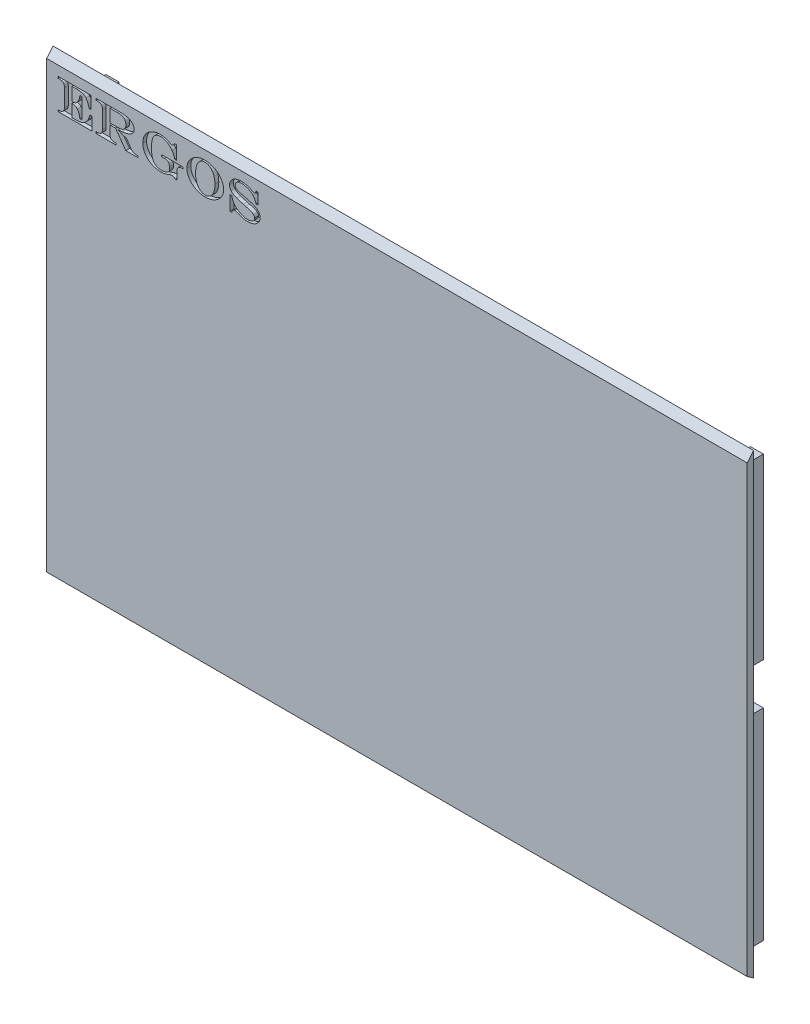
from build123d import *

# Parameters (mm, degrees)
SKETCH2_W           = 165.1
SKETCH2_H           = 107.67
BOSS_EXTRUDE1_DEPTH = 1.5
SKETCH3_W           = 3.025
SKETCH3_H           = 99.31
BOSS_EXTRUDE2_DEPTH = 7.4
CHAMFER2_SIZE2      = 1.5
CHAMFER2_SIZE       = 1.050311307
CHAMFER3_SIZE       = 1.78763
CHAMFER3_SIZE2      = 1.499999674
CUT_EXTRUDE1_START  = -0.9
CUT_EXTRUDE1_DEPTH  = 0.9
CUT_EXTRUDE3_DEPTH  = 169.985701635


# Read off the part's stored shape, not the designer's step: Cut-Extrude1
with BuildPart() as part:
    # Sketch2 → Boss-Extrude1 (new body)
    with BuildSketch(Plane.XY):
        Rectangle(SKETCH2_W, SKETCH2_H)
    extrude(amount=BOSS_EXTRUDE1_DEPTH)

    # Sketch3 → Boss-Extrude2 (add)
    with BuildSketch(Plane(origin=(0, 0, 0), x_dir=(-1, 0, 0), z_dir=(0, 0, -1))):
        with Locations((-75.9475, -2.79)):
            Rectangle(SKETCH3_W, SKETCH3_H)
        with Locations((75.9475, -2.79)):
            Rectangle(SKETCH3_W, SKETCH3_H)
    extrude(amount=BOSS_EXTRUDE2_DEPTH)

    # Chamfer2
    chamfer2_edges = [part.edges().sort_by_distance(p)[0] for p in [
        (0, -53.835, 1.5),
    ]]
    chamfer2_side = [part.faces().sort_by_distance(p)[0] for p in [
        (0, -53.813993774, 1.5),
    ]]
    chamfer(chamfer2_edges, length=CHAMFER2_SIZE - 0.0001, length2=CHAMFER2_SIZE2 - 0.0001, reference=chamfer2_side[0])  # a hair under: the kernel refuses the full size

    # Chamfer3
    chamfer3_edges = [part.edges().sort_by_distance(p)[0] for p in [
        (0, 53.835, 1.5),
    ]]
    chamfer3_side = [part.faces().sort_by_distance(p)[0] for p in [
        (0, 0.525105653, 1.5),
    ]]
    chamfer(chamfer3_edges, length=CHAMFER3_SIZE, length2=CHAMFER3_SIZE2, reference=chamfer3_side[0])

    # Cut-Extrude1 outline → Cut-Extrude1 (cut)
    # profile 1 of 5: a face of its own
    with BuildSketch(Plane.XY.offset(1.5).offset(CUT_EXTRUDE1_START)):
        with BuildLine():
            add(Edge.make_bspline(
                [(-33.673735662, 49.058404936), (-33.647669884, 49.060120862), (-33.595582847, 49.063549784), (-33.520661469, 49.092950171), (-33.451149091, 49.139881919), (-33.386971586, 49.205383568), (-33.327959262, 49.288723101), (-33.273314633, 49.389579844), (-33.225506474, 49.509347613), (-33.197899303, 49.595740547), (-33.183282237, 49.641482692)],
                knots=[0, 0, 0, 0, 0.095615682, 0.191068058, 0.291769804, 0.402365532, 0.526393257, 0.666376207, 0.823357453, 1, 1, 1, 1], degree=3))
            add(Edge.make_bspline(
                [(-34.173299676, 49.26339321), (-34.140982655, 49.247042087), (-34.080179814, 49.216278277), (-33.992963799, 49.175052767), (-33.915893654, 49.140408322), (-33.84878231, 49.111035811), (-33.791052071, 49.088194806), (-33.743193206, 49.071142096), (-33.705001579, 49.061145933), (-33.682878831, 49.059206493), (-33.673735662, 49.058404936)],
                knots=[0, 0, 0, 0, 0.200425727, 0.377090874, 0.533798689, 0.668043957, 0.782475738, 0.877256726, 0.949271104, 1, 1, 1, 1], degree=3))
            add(Edge.make_bspline(
                [(-36.640751115, 49.93302157), (-36.539436361, 49.93097345), (-36.335305179, 49.926846853), (-36.029049231, 49.893169463), (-35.721508087, 49.842266997), (-35.413335146, 49.768272915), (-35.103862812, 49.674432982), (-34.79333256, 49.558089886), (-34.481625112, 49.421560429), (-34.27704007, 49.316610777), (-34.173299676, 49.26339321)],
                knots=[0, 0, 0, 0, 0.117664495, 0.237072998, 0.357512053, 0.47958756, 0.604949098, 0.732946784, 0.864583425, 1, 1, 1, 1], degree=3))
            add(Edge.make_bspline(
                [(-39.439220655, 47.775330188), (-39.437921839, 47.826489355), (-39.435343094, 47.92806371), (-39.418738644, 48.078489295), (-39.389526529, 48.224574848), (-39.350056742, 48.366246521), (-39.299665423, 48.504004875), (-39.237565827, 48.637830562), (-39.162111436, 48.767035654), (-39.077767731, 48.89299768), (-38.982176633, 49.012768236), (-38.876613134, 49.124904904), (-38.763949491, 49.232485411), (-38.641097995, 49.33175593), (-38.510156405, 49.425261506), (-38.369789827, 49.509466024), (-38.222109182, 49.589756734), (-38.011053261, 49.683598145), (-37.733468429, 49.785205626), (-37.383709615, 49.870736743), (-37.017465594, 49.924357594), (-36.767982735, 49.930095397), (-36.640751115, 49.93302157)],
                knots=[0, 0, 0, 0, 0.038971493, 0.077376244, 0.115107398, 0.152338832, 0.189297768, 0.226728302, 0.264555857, 0.303159433, 0.342117573, 0.381127191, 0.420400756, 0.460685165, 0.501336906, 0.542862355, 0.585296084, 0.629298266, 0.718697782, 0.810057838, 0.903133029, 1, 1, 1, 1], degree=3))
            add(Edge.make_bspline(
                [(-39.109720986, 46.821755109), (-39.160412613, 46.89412855), (-39.260095793, 47.036448203), (-39.3629531, 47.27347774), (-39.42677966, 47.520926736), (-39.435043443, 47.689911196), (-39.439220655, 47.775330188)],
                knots=[0, 0, 0, 0, 0.257658078, 0.506674932, 0.750631924, 1, 1, 1, 1], degree=3))
            add(Edge.make_bspline(
                [(-37.767427403, 45.954730634), (-37.849624591, 45.986092463), (-38.005961505, 46.045741847), (-38.225791039, 46.138937584), (-38.416807379, 46.234928923), (-38.585707655, 46.329826588), (-38.735014527, 46.43367327), (-38.870610576, 46.550270248), (-38.997316951, 46.678829534), (-39.072117116, 46.773940502), (-39.109720986, 46.821755109)],
                knots=[0, 0, 0, 0, 0.162597773, 0.309256734, 0.441034827, 0.557526682, 0.667037542, 0.776516434, 0.887649353, 1, 1, 1, 1], degree=3))
            add(Edge.make_bspline(
                [(-36.174592597, 45.467314072), (-36.26719621, 45.493198806), (-36.444836615, 45.542853181), (-36.700545349, 45.613104364), (-36.932276243, 45.682474797), (-37.14286581, 45.743955337), (-37.330564216, 45.803043728), (-37.495746056, 45.858187432), (-37.639717616, 45.905789352), (-37.727040899, 45.939253611), (-37.767427403, 45.954730634)],
                knots=[0, 0, 0, 0, 0.17311511, 0.332084649, 0.477412506, 0.608598903, 0.727051977, 0.831656342, 0.92214205, 1, 1, 1, 1], degree=3))
            Line((-36.174592597, 45.467314072), (-35.671991719, 45.333692087))
            add(Edge.make_bspline(
                [(-33.796728626, 44.591179008), (-33.845518296, 44.633543594), (-33.951313904, 44.725407038), (-34.113806492, 44.810891346), (-34.262629116, 44.885039027), (-34.396398378, 44.939487759), (-34.54523939, 44.998003812), (-34.713628283, 45.056051977), (-34.907300142, 45.11737043), (-35.131172072, 45.185974893), (-35.390138912, 45.258362261), (-35.574253494, 45.307569929), (-35.671991719, 45.333692087)],
                knots=[0, 0, 0, 0, 0.095058532, 0.206125086, 0.269252981, 0.340546635, 0.419045255, 0.505254492, 0.603271131, 0.718797856, 0.850722316, 1, 1, 1, 1], degree=3))
            add(Edge.make_bspline(
                [(-33.518855633, 43.982287914), (-33.521739214, 44.03744219), (-33.527512365, 44.147865285), (-33.585407218, 44.306908392), (-33.672118463, 44.459292867), (-33.754198051, 44.546165076), (-33.796728626, 44.591179008)],
                knots=[0, 0, 0, 0, 0.239838849, 0.480175786, 0.730646522, 1, 1, 1, 1], degree=3))
            add(Edge.make_bspline(
                [(-35.172427705, 42.838908878), (-35.095906707, 42.840483853), (-34.94533557, 42.843582948), (-34.725724455, 42.873082112), (-34.516870049, 42.920436456), (-34.320683629, 42.984656087), (-34.140483111, 43.066185059), (-33.979546048, 43.161334306), (-33.841203294, 43.271865425), (-33.724420313, 43.394807773), (-33.633520773, 43.530222917), (-33.565809248, 43.673610636), (-33.527455433, 43.825940965), (-33.521734155, 43.929955518), (-33.518855633, 43.982287914)],
                knots=[0, 0, 0, 0, 0.102905249, 0.202487694, 0.297472894, 0.390713923, 0.479700354, 0.563083208, 0.641567444, 0.71720244, 0.790293303, 0.860063715, 0.929594457, 1, 1, 1, 1], degree=3))
            add(Edge.make_bspline(
                [(-38.23206749, 44.298121698), (-38.167910444, 44.228149255), (-38.037837462, 44.086286044), (-37.818981467, 43.892085828), (-37.583097649, 43.705181001), (-37.328260235, 43.533521062), (-37.063571178, 43.374002956), (-36.791009033, 43.23697358), (-36.517431371, 43.115601352), (-36.241847944, 43.016127478), (-35.967838025, 42.935670938), (-35.697191282, 42.883002186), (-35.433187293, 42.844279872), (-35.258608367, 42.840683983), (-35.172427705, 42.838908878)],
                knots=[0, 0, 0, 0, 0.081776267, 0.165794465, 0.25184825, 0.341026787, 0.430434453, 0.518036847, 0.603793757, 0.688252523, 0.77040959, 0.849636053, 0.925773031, 1, 1, 1, 1], degree=3))
            add(Edge.make_bspline(
                [(-38.897140554, 45.881845914), (-38.885882482, 45.804763759), (-38.863689511, 45.652812164), (-38.815438904, 45.430206512), (-38.751215289, 45.217969798), (-38.675021816, 45.014379529), (-38.585908156, 44.820107808), (-38.48229474, 44.635805115), (-38.364803978, 44.461187515), (-38.276448675, 44.352643664), (-38.23206749, 44.298121698)],
                knots=[0, 0, 0, 0, 0.134073388, 0.264298074, 0.391646335, 0.515443055, 0.638242392, 0.759173001, 0.879031733, 1, 1, 1, 1], degree=3))
            Line((-38.897140554, 45.881845914), (-39.349633188, 45.881845914))
            Line((-39.349633188, 45.881845914), (-39.349633188, 42.450190374))
            Line((-39.349633188, 42.450190374), (-38.906251144, 42.450190374))
            add(Edge.make_bspline(
                [(-38.14096159, 43.203332475), (-38.184141841, 43.201150991), (-38.268459438, 43.196891233), (-38.391564909, 43.16729847), (-38.505954248, 43.116529823), (-38.613537072, 43.045701856), (-38.712044736, 42.946618006), (-38.790131645, 42.810288084), (-38.859292595, 42.6430475), (-38.889842873, 42.517578574), (-38.906251144, 42.450190374)],
                knots=[0, 0, 0, 0, 0.109848072, 0.214499113, 0.320034099, 0.426842473, 0.540687667, 0.671896365, 0.823778573, 1, 1, 1, 1], degree=3))
            add(Edge.make_bspline(
                [(-37.170683763, 42.928496345), (-37.233255683, 42.954301308), (-37.34972671, 43.002334523), (-37.514081273, 43.061806018), (-37.6514323, 43.112135156), (-37.798476663, 43.155019466), (-37.957634701, 43.194904017), (-38.082002087, 43.20062181), (-38.14096159, 43.203332475)],
                knots=[0, 0, 0, 0, 0.200164531, 0.372585152, 0.516999432, 0.632577406, 0.825814033, 1, 1, 1, 1], degree=3))
            add(Edge.make_bspline(
                [(-35.19520418, 42.450190374), (-35.277750199, 42.451181867), (-35.440556368, 42.453137397), (-35.679777633, 42.47379149), (-35.910159487, 42.504853995), (-36.135859444, 42.551769882), (-36.367961602, 42.616165409), (-36.616246493, 42.700739509), (-36.887806941, 42.803734634), (-37.073374044, 42.885578276), (-37.170683763, 42.928496345)],
                knots=[0, 0, 0, 0, 0.120753913, 0.238163902, 0.35107058, 0.460731701, 0.575182342, 0.703288774, 0.844407304, 1, 1, 1, 1], degree=3))
            add(Edge.make_bspline(
                [(-32.859856295, 43.288364648), (-32.929152348, 43.221261623), (-33.068057332, 43.086752598), (-33.307048536, 42.916044104), (-33.569379958, 42.771918486), (-33.854455864, 42.653215348), (-34.161623115, 42.562590453), (-34.488480409, 42.49822785), (-34.835339716, 42.457768069), (-35.073108888, 42.452761344), (-35.19520418, 42.450190374)],
                knots=[0, 0, 0, 0, 0.113357576, 0.227226969, 0.34422936, 0.464878134, 0.589783684, 0.720342317, 0.856394812, 1, 1, 1, 1], degree=3))
            add(Edge.make_bspline(
                [(-32.240336179, 44.673174317), (-32.242510262, 44.613320772), (-32.246903701, 44.492367307), (-32.2791802, 44.310310695), (-32.328963113, 44.125947941), (-32.400507528, 43.942129074), (-32.489530944, 43.762808131), (-32.594102018, 43.59133289), (-32.717863277, 43.432282767), (-32.8123038, 43.336561845), (-32.859856295, 43.288364648)],
                knots=[0, 0, 0, 0, 0.11533341, 0.233068496, 0.355438412, 0.482999863, 0.612593659, 0.740943727, 0.869560528, 1, 1, 1, 1], degree=3))
            add(Edge.make_bspline(
                [(-32.831006093, 45.962322792), (-32.783165418, 45.914983318), (-32.689571937, 45.822370368), (-32.565218289, 45.673959831), (-32.465013829, 45.517252718), (-32.382325919, 45.357245457), (-32.317428034, 45.192628699), (-32.274538595, 45.023070252), (-32.245221371, 44.849818578), (-32.24197732, 44.73251653), (-32.240336179, 44.673174317)],
                knots=[0, 0, 0, 0, 0.138219231, 0.270406279, 0.396718167, 0.51947566, 0.639953373, 0.759231824, 0.878197213, 1, 1, 1, 1], degree=3))
            add(Edge.make_bspline(
                [(-35.14965123, 46.946266504), (-35.066580959, 46.924737281), (-34.905772941, 46.883060857), (-34.673703595, 46.818822232), (-34.457858733, 46.758379866), (-34.258936724, 46.700162116), (-34.07790442, 46.639736971), (-33.913185182, 46.584215412), (-33.764701317, 46.531700823), (-33.59330763, 46.461361383), (-33.398477867, 46.371797149), (-33.186145202, 46.250060834), (-32.995905809, 46.11564219), (-32.885141268, 46.012656246), (-32.831006093, 45.962322792)],
                knots=[0, 0, 0, 0, 0.101060651, 0.195633925, 0.283570652, 0.365043448, 0.439688609, 0.508301999, 0.569770025, 0.625115199, 0.726447956, 0.822045087, 0.913026136, 1, 1, 1, 1], degree=3))
            Line((-35.14965123, 46.946266504), (-35.54444346, 47.044964562))
            Line((-35.54444346, 47.044964562), (-35.798021547, 47.104183396))
            add(Edge.make_bspline(
                [(-36.03034159, 47.167957526), (-36.004082519, 47.159648349), (-35.956276432, 47.144521034), (-35.890681027, 47.126863524), (-35.839855235, 47.11240306), (-35.810201426, 47.106576552), (-35.798021547, 47.104183396)],
                knots=[0, 0, 0, 0, 0.342746122, 0.62398823, 0.845558529, 1, 1, 1, 1], degree=3))
            add(Edge.make_bspline(
                [(-37.899530957, 47.886175699), (-37.849610765, 47.84209994), (-37.744098786, 47.748940833), (-37.586253151, 47.655146231), (-37.438581115, 47.58746075), (-37.308560154, 47.533762477), (-37.161402291, 47.481308425), (-36.994234433, 47.427365358), (-36.800753203, 47.370438735), (-36.575298808, 47.308890048), (-36.314519498, 47.240455697), (-36.12907055, 47.193144808), (-36.03034159, 47.167957526)],
                knots=[0, 0, 0, 0, 0.098621157, 0.208446982, 0.27058147, 0.339592069, 0.417008968, 0.502239864, 0.600106632, 0.716123941, 0.848870602, 1, 1, 1, 1], degree=3))
            add(Edge.make_bspline(
                [(-38.106037662, 48.429774231), (-38.103427841, 48.375366709), (-38.09843043, 48.271184568), (-38.059917745, 48.123201867), (-37.994672459, 47.992289745), (-37.931100055, 47.921385619), (-37.899530957, 47.886175699)],
                knots=[0, 0, 0, 0, 0.273181187, 0.523100483, 0.763178887, 1, 1, 1, 1], degree=3))
            add(Edge.make_bspline(
                [(-37.811461921, 49.113068476), (-37.849402452, 49.069102291), (-37.930095487, 48.975593718), (-38.022996404, 48.809110417), (-38.091731545, 48.623993348), (-38.101335529, 48.49361016), (-38.106037662, 48.429774231)],
                knots=[0, 0, 0, 0, 0.228673321, 0.486349129, 0.74851527, 1, 1, 1, 1], degree=3))
            add(Edge.make_bspline(
                [(-36.651380137, 49.544303066), (-36.710643153, 49.543176856), (-36.825921369, 49.540986156), (-36.994174447, 49.522825824), (-37.1516926, 49.491155038), (-37.299424557, 49.447103052), (-37.43865033, 49.388471915), (-37.570860179, 49.314037159), (-37.696767574, 49.222214799), (-37.772757342, 49.149900828), (-37.811461921, 49.113068476)],
                knots=[0, 0, 0, 0, 0.13957811, 0.271506861, 0.398006454, 0.517573642, 0.634051402, 0.753100297, 0.874244264, 1, 1, 1, 1], degree=3))
            add(Edge.make_bspline(
                [(-33.906055705, 48.420663641), (-33.954721651, 48.474724372), (-34.05353149, 48.584487618), (-34.221759228, 48.734507055), (-34.408778243, 48.874672166), (-34.612527591, 49.006027576), (-34.832761571, 49.125849701), (-35.067291922, 49.232142306), (-35.315415055, 49.324842086), (-35.574791455, 49.4024774), (-35.840540156, 49.467354935), (-36.110279982, 49.510071288), (-36.380464049, 49.539143964), (-36.561210914, 49.542585958), (-36.651380137, 49.544303066)],
                knots=[0, 0, 0, 0, 0.071444271, 0.145058251, 0.221065176, 0.300954302, 0.38309134, 0.467237206, 0.553809308, 0.643191066, 0.733196278, 0.82241456, 0.911407917, 1, 1, 1, 1], degree=3))
            add(Edge.make_bspline(
                [(-33.180245374, 47.017632792), (-33.208337886, 47.092634667), (-33.263034541, 47.238664746), (-33.347014993, 47.450197084), (-33.435909051, 47.646137155), (-33.524677309, 47.829196061), (-33.618000577, 47.996984582), (-33.709508621, 48.152859964), (-33.80538385, 48.293025831), (-33.873197945, 48.379004604), (-33.906055705, 48.420663641)],
                knots=[0, 0, 0, 0, 0.151415398, 0.294808661, 0.43014741, 0.558099912, 0.679294196, 0.793016882, 0.89971109, 1, 1, 1, 1], degree=3))
            Line((-33.180245374, 47.017632792), (-32.739900194, 47.017632792))
            Line((-32.739900194, 47.017632792), (-32.739900194, 49.641482692))
            Line((-32.739900194, 49.641482692), (-33.183282237, 49.641482692))
        make_face()
    # profile 2 of 5: a face of its own
    with BuildSketch(Plane.XY.offset(1.5).offset(CUT_EXTRUDE1_START)):
        with BuildLine():
            add(Edge.make_bspline(
                [(-49.491238211, 46.187050677), (-49.489560572, 46.270143274), (-49.486226831, 46.43526183), (-49.45721728, 46.680212896), (-49.414515606, 46.921264478), (-49.349395676, 47.156784148), (-49.26901096, 47.388938069), (-49.170110295, 47.616099405), (-49.05411747, 47.839772879), (-48.919046816, 48.056740051), (-48.769823451, 48.267026564), (-48.606404837, 48.465902676), (-48.433072369, 48.655567095), (-48.246270271, 48.833033428), (-48.046475863, 48.998794218), (-47.83564962, 49.153613511), (-47.612537735, 49.29712693), (-47.378334243, 49.428570832), (-47.134801202, 49.546388719), (-46.885370175, 49.649826671), (-46.631590895, 49.738359595), (-46.37244517, 49.810107776), (-46.107997281, 49.864312475), (-45.838806677, 49.903582377), (-45.565067966, 49.929126504), (-45.38090027, 49.931717615), (-45.28821939, 49.93302157)],
                knots=[0, 0, 0, 0, 0.039950268, 0.079387706, 0.11849316, 0.157586488, 0.196773689, 0.236570132, 0.276638895, 0.317848719, 0.359391541, 0.400567558, 0.441571949, 0.482897373, 0.524383096, 0.566353807, 0.608624899, 0.651894979, 0.695445596, 0.738664974, 0.78170091, 0.824637586, 0.867892599, 0.911443216, 0.955434526, 1, 1, 1, 1], degree=3))
            add(Edge.make_bspline(
                [(-45.184966038, 42.450190374), (-45.330370878, 42.453906697), (-45.618048879, 42.461259302), (-46.042555457, 42.513259154), (-46.4535038, 42.6018761), (-46.849104611, 42.72490675), (-47.227298174, 42.878634635), (-47.582995926, 43.066145604), (-47.918474705, 43.279306759), (-48.227925779, 43.524435387), (-48.509865163, 43.793623942), (-48.761253782, 44.085643982), (-48.979103416, 44.399573969), (-49.162895958, 44.733128493), (-49.308982454, 45.082271182), (-49.414501681, 45.442643138), (-49.478703093, 45.812235376), (-49.487048843, 46.06178348), (-49.491238211, 46.187050677)],
                knots=[0, 0, 0, 0, 0.068900731, 0.136317501, 0.202323329, 0.267873014, 0.332415683, 0.395501385, 0.458179017, 0.520514241, 0.582266648, 0.642651566, 0.702801641, 0.763026277, 0.822807443, 0.881784886, 0.940658832, 1, 1, 1, 1], degree=3))
            add(Edge.make_bspline(
                [(-40.842251504, 46.170347929), (-40.844159116, 46.08829745), (-40.847948393, 45.925312451), (-40.873568766, 45.68289848), (-40.920113437, 45.445693825), (-40.982091324, 45.211973022), (-41.063280554, 44.982947846), (-41.159977762, 44.756799153), (-41.278087362, 44.536993922), (-41.41120615, 44.321792549), (-41.559646383, 44.114146564), (-41.722616774, 43.916436335), (-41.898533832, 43.729069068), (-42.089843096, 43.554846823), (-42.291880544, 43.387956644), (-42.508872287, 43.233745267), (-42.739676333, 43.090796221), (-42.981044837, 42.957735722), (-43.232554349, 42.837359282), (-43.492749801, 42.734796507), (-43.758592926, 42.645942716), (-44.031674394, 42.574962763), (-44.310880196, 42.518245513), (-44.597000721, 42.479694736), (-44.888906949, 42.454018752), (-45.085706205, 42.451473916), (-45.184966038, 42.450190374)],
                knots=[0, 0, 0, 0, 0.038790927, 0.077054263, 0.115066877, 0.152969373, 0.191262626, 0.22984635, 0.269131561, 0.30910595, 0.349411987, 0.389700974, 0.430157312, 0.470800745, 0.511948215, 0.553978872, 0.596540195, 0.64023465, 0.684224912, 0.728259406, 0.772374445, 0.816658539, 0.861568531, 0.906982486, 0.953084666, 1, 1, 1, 1], degree=3))
            add(Edge.make_bspline(
                [(-41.943114454, 48.662094274), (-41.855865413, 48.568408697), (-41.684608671, 48.384518005), (-41.460863718, 48.087820246), (-41.269612444, 47.782455607), (-41.114767309, 47.467024487), (-40.992610389, 47.146857909), (-40.905568015, 46.822880307), (-40.851739801, 46.497104161), (-40.845402498, 46.278861284), (-40.842251504, 46.170347929)],
                knots=[0, 0, 0, 0, 0.137402136, 0.269699722, 0.398353005, 0.523782047, 0.646434017, 0.765755337, 0.883530337, 1, 1, 1, 1], degree=3))
            add(Edge.make_bspline(
                [(-45.28821939, 49.93302157), (-45.203152693, 49.932455602), (-45.03487138, 49.931335989), (-44.785230415, 49.913042689), (-44.540435974, 49.888082098), (-44.30075001, 49.851594887), (-44.066599066, 49.804653786), (-43.838112517, 49.746649446), (-43.614998962, 49.678647293), (-43.397843452, 49.599386162), (-43.187295174, 49.511264418), (-42.983424659, 49.416345862), (-42.789239192, 49.311094906), (-42.602880117, 49.198639081), (-42.425525255, 49.076709335), (-42.254893271, 48.94806435), (-42.093726798, 48.809977581), (-41.99318835, 48.711260851), (-41.943114454, 48.662094274)],
                knots=[0, 0, 0, 0, 0.069453335, 0.137394525, 0.204313319, 0.27037126, 0.335303558, 0.399264219, 0.462809485, 0.52570479, 0.587961187, 0.649165833, 0.709271917, 0.768251742, 0.826837729, 0.884955231, 0.942701126, 1, 1, 1, 1], degree=3))
        make_face()
        with BuildLine():
            add(Edge.make_bspline(
                [(-44.190393304, 49.248208893), (-44.261130594, 49.290561368), (-44.408191205, 49.378610838), (-44.65371519, 49.465658229), (-44.905190914, 49.532558604), (-45.075742646, 49.540493209), (-45.157634268, 49.544303066)],
                knots=[0, 0, 0, 0, 0.2410126, 0.501057651, 0.7604293, 1, 1, 1, 1], degree=3))
            add(Edge.make_bspline(
                [(-42.883023649, 46.238677353), (-42.884410589, 46.351630034), (-42.887140001, 46.573913877), (-42.919487062, 46.900835758), (-42.966437803, 47.216758557), (-43.037225411, 47.519157939), (-43.12220603, 47.806836735), (-43.225743511, 48.076253198), (-43.347066729, 48.324950993), (-43.483973553, 48.554670166), (-43.637293388, 48.76243956), (-43.804445754, 48.949885517), (-43.989337707, 49.112093598), (-44.123598803, 49.202988798), (-44.190393304, 49.248208893)],
                knots=[0, 0, 0, 0, 0.099026676, 0.194878331, 0.287858186, 0.378957216, 0.46701283, 0.550768689, 0.631768914, 0.709420604, 0.784975818, 0.857895264, 0.929303312, 1, 1, 1, 1], degree=3))
            add(Edge.make_bspline(
                [(-45.218371534, 42.838908878), (-45.160092989, 42.839865246), (-45.044709681, 42.841758719), (-44.875447428, 42.863120452), (-44.710769818, 42.891836148), (-44.553607526, 42.939006038), (-44.400410044, 42.99409037), (-44.254324671, 43.06531291), (-44.11302799, 43.146496337), (-43.978895472, 43.241691796), (-43.851023796, 43.347841365), (-43.731157547, 43.466690196), (-43.618788281, 43.596697947), (-43.511547808, 43.736027989), (-43.414990605, 43.888721282), (-43.325187286, 44.052207203), (-43.241505594, 44.226170886), (-43.167494283, 44.412182697), (-43.101219978, 44.607962569), (-43.040782844, 44.813177559), (-42.994069482, 45.028718393), (-42.951414977, 45.252695921), (-42.922769717, 45.486143844), (-42.899245907, 45.728599655), (-42.885591187, 45.980386972), (-42.883889193, 46.151604963), (-42.883023649, 46.238677353)],
                knots=[0, 0, 0, 0, 0.037767174, 0.074773683, 0.110500551, 0.146026344, 0.181022088, 0.215960839, 0.251256955, 0.286588151, 0.322475969, 0.358913384, 0.395902423, 0.433844608, 0.472812063, 0.512915722, 0.554754672, 0.597905466, 0.642639894, 0.688760357, 0.736535179, 0.785589384, 0.836558457, 0.888975832, 0.943538996, 1, 1, 1, 1], degree=3))
            add(Edge.make_bspline(
                [(-47.450466067, 46.173384792), (-47.448595445, 46.04676828), (-47.444945222, 45.79969624), (-47.411581299, 45.438769795), (-47.362054013, 45.09632591), (-47.28667106, 44.774518848), (-47.195020806, 44.473175968), (-47.08435708, 44.194775175), (-46.956224667, 43.938972846), (-46.811789782, 43.706809036), (-46.650221631, 43.501731055), (-46.478815758, 43.322382829), (-46.294906951, 43.171647355), (-46.099410128, 43.049295645), (-45.893159924, 42.954490092), (-45.676846595, 42.887133684), (-45.45067107, 42.846921175), (-45.296479199, 42.841602907), (-45.218371534, 42.838908878)],
                knots=[0, 0, 0, 0, 0.084896836, 0.165662711, 0.242907028, 0.316768572, 0.387097901, 0.453978153, 0.517434321, 0.578747888, 0.637012528, 0.692227878, 0.744820295, 0.796058783, 0.846486888, 0.896626254, 0.947634841, 1, 1, 1, 1], degree=3))
            add(Edge.make_bspline(
                [(-46.560665117, 48.967299037), (-46.602907844, 48.919831867), (-46.689920806, 48.822057425), (-46.810267529, 48.658268466), (-46.92312732, 48.473520105), (-47.032707876, 48.271699693), (-47.129772551, 48.05243645), (-47.21746943, 47.820688137), (-47.2896933, 47.575921469), (-47.349015452, 47.318834398), (-47.393706974, 47.049941265), (-47.427610402, 46.768819958), (-47.447374829, 46.475334793), (-47.449424245, 46.275149207), (-47.450466067, 46.173384792)],
                knots=[0, 0, 0, 0, 0.063510628, 0.130821285, 0.202866299, 0.279850497, 0.360268004, 0.442423182, 0.527446273, 0.615221763, 0.706075612, 0.799857734, 0.898257607, 1, 1, 1, 1], degree=3))
            add(Edge.make_bspline(
                [(-45.157634268, 49.544303066), (-45.224015742, 49.542447384), (-45.355257774, 49.538778538), (-45.549132781, 49.512718808), (-45.736962417, 49.467951309), (-45.919359435, 49.407680372), (-46.095501958, 49.329061067), (-46.260662842, 49.227761264), (-46.418369431, 49.108588783), (-46.512599934, 49.015024429), (-46.560665117, 48.967299037)],
                knots=[0, 0, 0, 0, 0.127582399, 0.252241659, 0.375188359, 0.498250484, 0.621039261, 0.745009464, 0.869934191, 1, 1, 1, 1], degree=3))
        make_face(mode=Mode.SUBTRACT)
    # profile 3 of 5: a face of its own
    with BuildSketch(Plane.XY.offset(1.5).offset(CUT_EXTRUDE1_START)):
        with BuildLine():
            add(Edge.make_bspline(
                [(-53.085365938, 49.155584562), (-53.059917363, 49.157160265), (-53.007546073, 49.160402944), (-52.9289739, 49.184291273), (-52.851675, 49.225177348), (-52.770927146, 49.280381278), (-52.68597198, 49.358006405), (-52.592257141, 49.459860552), (-52.491472566, 49.590380242), (-52.422482779, 49.686794942), (-52.385368945, 49.738662318)],
                knots=[0, 0, 0, 0, 0.080825371, 0.166332652, 0.258410516, 0.357902822, 0.47638606, 0.623217043, 0.79730536, 1, 1, 1, 1], degree=3))
            add(Edge.make_bspline(
                [(-53.622890744, 49.369683426), (-53.588974696, 49.352993938), (-53.52479604, 49.321412757), (-53.433849431, 49.276424483), (-53.351740685, 49.240792257), (-53.280478935, 49.209409413), (-53.21791193, 49.186578162), (-53.165179743, 49.170303442), (-53.122378025, 49.157726344), (-53.096559641, 49.156232309), (-53.085365938, 49.155584562)],
                knots=[0, 0, 0, 0, 0.195106327, 0.36919579, 0.523568034, 0.657002843, 0.771052385, 0.866894112, 0.942291204, 1, 1, 1, 1], degree=3))
            add(Edge.make_bspline(
                [(-55.854985277, 49.93302157), (-55.762816021, 49.931101844), (-55.578126566, 49.927255083), (-55.302575895, 49.90135254), (-55.028962438, 49.856378383), (-54.755497626, 49.795697296), (-54.479786425, 49.71523289), (-54.198012412, 49.619974658), (-53.91089431, 49.504184022), (-53.720177282, 49.415117229), (-53.622890744, 49.369683426)],
                knots=[0, 0, 0, 0, 0.119079741, 0.238612888, 0.35719242, 0.477132702, 0.600281621, 0.728080837, 0.861291494, 1, 1, 1, 1], degree=3))
            add(Edge.make_bspline(
                [(-58.86755368, 48.701573497), (-58.799563724, 48.765293601), (-58.66401372, 48.892330899), (-58.445608332, 49.065711661), (-58.216294048, 49.223102931), (-57.97730981, 49.36691529), (-57.72821242, 49.492916078), (-57.473208597, 49.608330366), (-57.209922298, 49.704689923), (-56.941898358, 49.78684219), (-56.670662078, 49.852135121), (-56.398417912, 49.899650416), (-56.126363126, 49.927578234), (-55.945140558, 49.931213222), (-55.854985277, 49.93302157)],
                knots=[0, 0, 0, 0, 0.083855212, 0.167180196, 0.250719166, 0.334093964, 0.418048143, 0.50187488, 0.585919266, 0.670234922, 0.754112412, 0.836883711, 0.918852297, 1, 1, 1, 1], degree=3))
            add(Edge.make_bspline(
                [(-59.889458184, 46.109610662), (-59.887900675, 46.190639562), (-59.884809546, 46.351454612), (-59.862969322, 46.591351858), (-59.827067035, 46.827815239), (-59.774434559, 47.060759821), (-59.710545495, 47.28960479), (-59.628953374, 47.511074425), (-59.53690482, 47.726149449), (-59.429248222, 47.933499375), (-59.31024572, 48.135584347), (-59.174834419, 48.329852026), (-59.030155903, 48.521359722), (-58.922122254, 48.641094566), (-58.86755368, 48.701573497)],
                knots=[0, 0, 0, 0, 0.085162435, 0.169018722, 0.252988002, 0.336370426, 0.419896986, 0.502529277, 0.584260977, 0.665635216, 0.747932875, 0.830570303, 0.91441984, 1, 1, 1, 1], degree=3))
            add(Edge.make_bspline(
                [(-55.604444054, 42.353010748), (-55.753398342, 42.3560328), (-56.047166586, 42.361992903), (-56.479576599, 42.41479764), (-56.896376995, 42.501879514), (-57.296855709, 42.62055547), (-57.676158749, 42.774118574), (-58.032052422, 42.956930802), (-58.362940279, 43.168416929), (-58.667587276, 43.408543557), (-58.942445277, 43.676071823), (-59.186642396, 43.966779435), (-59.397359016, 44.280571432), (-59.575669621, 44.614123575), (-59.715518932, 44.967231318), (-59.81582356, 45.335853527), (-59.878781922, 45.718223834), (-59.885875674, 45.978277515), (-59.889458184, 46.109610662)],
                knots=[0, 0, 0, 0, 0.070218678, 0.138485558, 0.205048106, 0.270818171, 0.335171607, 0.397724176, 0.45923029, 0.520063108, 0.5803187, 0.639786367, 0.698767343, 0.758238842, 0.81780557, 0.877443501, 0.938106122, 1, 1, 1, 1], degree=3))
            add(Edge.make_bspline(
                [(-53.868876672, 42.700731597), (-53.953698574, 42.66975335), (-54.114455702, 42.611042405), (-54.346758349, 42.536741777), (-54.555576893, 42.475296197), (-54.748877511, 42.427485659), (-54.940391578, 42.392045692), (-55.144508263, 42.37118946), (-55.367809834, 42.354721924), (-55.523424681, 42.353596625), (-55.604444054, 42.353010748)],
                knots=[0, 0, 0, 0, 0.152008665, 0.288091587, 0.410521598, 0.518402402, 0.623196942, 0.738091602, 0.863639912, 1, 1, 1, 1], degree=3))
            add(Edge.make_bspline(
                [(-53.009444355, 42.919385755), (-53.068773939, 42.91774317), (-53.18455117, 42.914537788), (-53.330651088, 42.890125889), (-53.456026596, 42.857463795), (-53.571766909, 42.816479061), (-53.712963681, 42.765058541), (-53.813869503, 42.723426582), (-53.868876672, 42.700731597)],
                knots=[0, 0, 0, 0, 0.19904517, 0.388421714, 0.495567048, 0.633647398, 0.800288835, 1, 1, 1, 1], degree=3))
            add(Edge.make_bspline(
                [(-52.239599506, 42.567109612), (-52.277643647, 42.602012402), (-52.348081205, 42.666633846), (-52.451978004, 42.749480839), (-52.543687555, 42.812669031), (-52.628764997, 42.857290265), (-52.713858375, 42.884468305), (-52.803342493, 42.907103998), (-52.903495253, 42.91603761), (-52.973000795, 42.918234086), (-53.009444355, 42.919385755)],
                knots=[0, 0, 0, 0, 0.17709764, 0.327890846, 0.455526907, 0.558820888, 0.656023135, 0.761326662, 0.874857374, 1, 1, 1, 1], degree=3))
            Line((-52.239599506, 42.567109612), (-51.823549233, 42.567109612))
            Line((-51.823549233, 42.567109612), (-51.823549233, 44.351266806))
            add(Edge.make_bspline(
                [(-50.740907463, 45.559938403), (-50.784451213, 45.558912819), (-50.869181592, 45.556917168), (-50.992360225, 45.545854413), (-51.106904145, 45.522220327), (-51.213115718, 45.492188307), (-51.311834506, 45.455057829), (-51.400003132, 45.405196907), (-51.481596774, 45.349083673), (-51.554737498, 45.283470136), (-51.620464033, 45.207829253), (-51.674368097, 45.11904454), (-51.719776626, 45.019378459), (-51.758068887, 44.908594961), (-51.787953135, 44.786110922), (-51.809037527, 44.651525254), (-51.820755844, 44.505343775), (-51.822594519, 44.403926645), (-51.823549233, 44.351266806)],
                knots=[0, 0, 0, 0, 0.069718191, 0.135662379, 0.197629528, 0.256611802, 0.312279157, 0.36594734, 0.418315558, 0.470526863, 0.522813545, 0.578120091, 0.636120428, 0.697870045, 0.765465796, 0.837658587, 0.915705831, 1, 1, 1, 1], degree=3))
            Line((-50.740907463, 45.559938403), (-50.385594456, 45.559938403))
            Line((-50.385594456, 45.559938403), (-50.385594456, 45.948656907))
            Line((-50.385594456, 45.948656907), (-55.499672269, 45.948656907))
            Line((-55.499672269, 45.948656907), (-55.499672269, 45.559938403))
            Line((-55.499672269, 45.559938403), (-54.781454097, 45.559938403))
            add(Edge.make_bspline(
                [(-53.572782499, 44.351266806), (-53.573660427, 44.399883281), (-53.575374209, 44.494786363), (-53.588531175, 44.632528748), (-53.61281193, 44.760534477), (-53.646607224, 44.878852952), (-53.68835076, 44.988136668), (-53.740620227, 45.087792338), (-53.801444705, 45.17867241), (-53.87355666, 45.259164243), (-53.954048492, 45.331276198), (-54.044928565, 45.392100676), (-54.144584235, 45.444370143), (-54.25386795, 45.486113678), (-54.372186426, 45.519908973), (-54.500192154, 45.544189727), (-54.637934539, 45.557346693), (-54.732837622, 45.559060476), (-54.781454097, 45.559938403)],
                knots=[0, 0, 0, 0, 0.074361619, 0.145159578, 0.211363504, 0.273364158, 0.33317502, 0.389968325, 0.445155765, 0.5, 0.554844235, 0.610031675, 0.66682498, 0.726635842, 0.788636496, 0.854840422, 0.925638381, 1, 1, 1, 1], degree=3))
            Line((-53.572782499, 44.351266806), (-53.572782499, 43.980769482))
            add(Edge.make_bspline(
                [(-54.040459449, 43.124374029), (-54.003435839, 43.151484879), (-53.931141718, 43.204422859), (-53.83466312, 43.294448073), (-53.753048042, 43.392160694), (-53.688311735, 43.497693759), (-53.635016527, 43.608094736), (-53.59873259, 43.726308612), (-53.577360044, 43.85143026), (-53.574326019, 43.937157114), (-53.572782499, 43.980769482)],
                knots=[0, 0, 0, 0, 0.135042791, 0.263691198, 0.387544651, 0.508723551, 0.627401738, 0.747614321, 0.871602227, 1, 1, 1, 1], degree=3))
            add(Edge.make_bspline(
                [(-55.561927967, 42.741729252), (-55.491000094, 42.742587012), (-55.348819668, 42.744306459), (-55.136673194, 42.767995785), (-54.924271312, 42.798189588), (-54.716628251, 42.845538477), (-54.51879024, 42.902019642), (-54.338626303, 42.966088543), (-54.179568727, 43.038712719), (-54.085508075, 43.096633792), (-54.040459449, 43.124374029)],
                knots=[0, 0, 0, 0, 0.133933598, 0.268480292, 0.402911394, 0.539099662, 0.670454854, 0.791453351, 0.900120403, 1, 1, 1, 1], degree=3))
            add(Edge.make_bspline(
                [(-57.466041263, 43.797039252), (-57.438310857, 43.751587478), (-57.383939846, 43.662470178), (-57.294097534, 43.539002201), (-57.202853154, 43.425043771), (-57.075244235, 43.289534127), (-56.899443719, 43.139760571), (-56.665473995, 42.990898254), (-56.412316907, 42.875754746), (-56.143022481, 42.795780536), (-55.85809236, 42.75003373), (-55.662311679, 42.744544021), (-55.561927967, 42.741729252)],
                knots=[0, 0, 0, 0, 0.069736716, 0.136732789, 0.199914311, 0.260906845, 0.380389184, 0.501447697, 0.623131325, 0.743570609, 0.86851954, 1, 1, 1, 1], degree=3))
            add(Edge.make_bspline(
                [(-57.84868604, 46.001802015), (-57.847177818, 45.87979198), (-57.844252843, 45.643171239), (-57.823378306, 45.302112455), (-57.788718662, 44.990041683), (-57.743076232, 44.705094311), (-57.683320008, 44.437278868), (-57.624788152, 44.222764733), (-57.575059056, 44.059816587), (-57.537095458, 43.95634157), (-57.502795552, 43.8696522), (-57.477496153, 43.819669898), (-57.466041263, 43.797039252)],
                knots=[0, 0, 0, 0, 0.162384967, 0.314922058, 0.454556559, 0.580145161, 0.698807313, 0.819573333, 0.876035624, 0.92547449, 0.966256847, 1, 1, 1, 1], degree=3))
            add(Edge.make_bspline(
                [(-57.100099234, 49.012851987), (-57.130464559, 48.980395178), (-57.192381755, 48.914213291), (-57.277688453, 48.804290578), (-57.355682872, 48.682747412), (-57.429957531, 48.550971439), (-57.495425358, 48.407202219), (-57.556548483, 48.252563988), (-57.612582814, 48.087441688), (-57.662642803, 47.910564135), (-57.707028985, 47.721116562), (-57.743851528, 47.517705344), (-57.778462211, 47.30023796), (-57.80250514, 47.067972351), (-57.8250724, 46.822085797), (-57.837190923, 46.561682539), (-57.847234331, 46.286839046), (-57.84819362, 46.098486598), (-57.84868604, 46.001802015)],
                knots=[0, 0, 0, 0, 0.041998368, 0.085637849, 0.131287141, 0.178406978, 0.228496052, 0.280468996, 0.335540363, 0.393240225, 0.454166296, 0.51938204, 0.588602368, 0.66225254, 0.740046994, 0.821971666, 0.908614963, 1, 1, 1, 1], degree=3))
            add(Edge.make_bspline(
                [(-55.730473881, 49.544303066), (-55.791809537, 49.54244478), (-55.915007237, 49.53871226), (-56.099886705, 49.511457526), (-56.286032865, 49.469248152), (-56.470218021, 49.408640448), (-56.648706179, 49.334641492), (-56.813205055, 49.242110548), (-56.966354928, 49.138096286), (-57.055549513, 49.054570388), (-57.100099234, 49.012851987)],
                knots=[0, 0, 0, 0, 0.122293046, 0.245635623, 0.371989885, 0.502552279, 0.631919004, 0.756633602, 0.878446599, 1, 1, 1, 1], degree=3))
            add(Edge.make_bspline(
                [(-52.973001996, 48.025871411), (-53.014480595, 48.082954052), (-53.097180866, 48.19676575), (-53.230183299, 48.359748111), (-53.374430687, 48.510637193), (-53.522264859, 48.65700655), (-53.682504563, 48.789102439), (-53.848823227, 48.914785677), (-54.022767596, 49.031643111), (-54.204748995, 49.13733837), (-54.390450772, 49.232174258), (-54.577779114, 49.317190733), (-54.767582887, 49.385958967), (-54.957781991, 49.444838819), (-55.149317037, 49.488297985), (-55.341927282, 49.520445959), (-55.535660806, 49.541136804), (-55.665636769, 49.54324928), (-55.730473881, 49.544303066)],
                knots=[0, 0, 0, 0, 0.064750178, 0.129099277, 0.192847104, 0.256243682, 0.319878031, 0.383233758, 0.447517446, 0.512045667, 0.576235314, 0.638818434, 0.700685581, 0.761369704, 0.821424848, 0.88075715, 0.940516986, 1, 1, 1, 1], degree=3))
            add(Edge.make_bspline(
                [(-52.338297564, 46.533253094), (-52.368259683, 46.630562588), (-52.424457583, 46.813079363), (-52.509039283, 47.066378973), (-52.587447098, 47.28136239), (-52.683141682, 47.512371918), (-52.801696168, 47.762219055), (-52.917469565, 47.940402888), (-52.973001996, 48.025871411)],
                knots=[0, 0, 0, 0, 0.187549168, 0.351773169, 0.491890154, 0.608936765, 0.812420707, 1, 1, 1, 1], degree=3))
            Line((-52.338297564, 46.533253094), (-51.908581406, 46.533253094))
            Line((-51.908581406, 46.533253094), (-51.961726513, 49.738662318))
            Line((-51.961726513, 49.738662318), (-52.385368945, 49.738662318))
        make_face()
    # profile 4 of 5: a face of its own
    with BuildSketch(Plane.XY.offset(1.5).offset(CUT_EXTRUDE1_START)):
        with BuildLine():
            add(Edge.make_bspline(
                [(-67.663828257, 44.102244015), (-67.662889873, 44.051604992), (-67.661085307, 43.954223294), (-67.649155969, 43.813633787), (-67.628572329, 43.68447598), (-67.597746426, 43.566806685), (-67.560375793, 43.459528934), (-67.51316604, 43.363025189), (-67.457053308, 43.277793916), (-67.392560404, 43.203213869), (-67.318163453, 43.141056803), (-67.237049112, 43.085585291), (-67.147381946, 43.038731902), (-67.049176351, 43.000305746), (-66.942505091, 42.972378005), (-66.827930183, 42.950560432), (-66.704921183, 42.939001139), (-66.620180327, 42.937077222), (-66.576631192, 42.936088504)],
                knots=[0, 0, 0, 0, 0.082520417, 0.158691418, 0.22974685, 0.295366456, 0.356676582, 0.414591378, 0.469953594, 0.522562169, 0.574631289, 0.62747857, 0.682452318, 0.739126214, 0.798953626, 0.86188466, 0.929021209, 1, 1, 1, 1], degree=3))
            Line((-67.663828257, 44.102244015), (-67.663828257, 45.948656907))
            Line((-67.663828257, 45.948656907), (-66.326089969, 45.948656907))
            Line((-66.326089969, 45.948656907), (-63.889007163, 42.54737))
            Line((-63.889007163, 42.54737), (-61.025245062, 42.54737))
            Line((-61.025245062, 42.54737), (-61.025245062, 42.936088504))
            Line((-61.025245062, 42.936088504), (-61.415481997, 42.936088504))
            add(Edge.make_bspline(
                [(-62.211140184, 43.113745007), (-62.161348044, 43.086053194), (-62.055855241, 43.027383554), (-61.86886209, 42.973845742), (-61.652568669, 42.940818613), (-61.497627663, 42.93772739), (-61.415481997, 42.936088504)],
                knots=[0, 0, 0, 0, 0.206473268, 0.43744743, 0.701749352, 1, 1, 1, 1], degree=3))
            add(Edge.make_bspline(
                [(-63.132828199, 44.273826792), (-63.083228445, 44.199071117), (-62.988277059, 44.055962445), (-62.844051354, 43.856234972), (-62.713165485, 43.67433963), (-62.588854586, 43.515926567), (-62.476528822, 43.379630908), (-62.375713632, 43.269226054), (-62.291811021, 43.180076436), (-62.235841866, 43.134055914), (-62.211140184, 43.113745007)],
                knots=[0, 0, 0, 0, 0.181120289, 0.346727978, 0.497375848, 0.633526611, 0.753252842, 0.8538262, 0.935486991, 1, 1, 1, 1], degree=3))
            add(Edge.make_bspline(
                [(-63.562544357, 44.90549436), (-63.536708903, 44.868055105), (-63.488946513, 44.798840596), (-63.422445827, 44.701791122), (-63.367495198, 44.61930473), (-63.304211414, 44.527034266), (-63.22744847, 44.413541861), (-63.165732674, 44.322413114), (-63.132828199, 44.273826792)],
                knots=[0, 0, 0, 0, 0.178623159, 0.330223293, 0.461970904, 0.567814805, 0.769575573, 1, 1, 1, 1], degree=3))
            Line((-63.562544357, 44.90549436), (-63.737163997, 45.1712199))
            add(Edge.make_bspline(
                [(-65.682894431, 45.949040348), (-65.626825668, 45.914472487), (-65.466339457, 45.817061723), (-65.198994849, 45.669268878), (-64.877335485, 45.518024725), (-64.604138048, 45.408366111), (-64.371725893, 45.333862718), (-64.178345477, 45.277991476), (-63.964534639, 45.223327728), (-63.815190355, 45.189101646), (-63.737163997, 45.1712199)],
                knots=[0.082249325, 0.082249325, 0.082249325, 0.082249325, 0.168304452, 0.327528884, 0.481054288, 0.632463067, 0.711719524, 0.799828005, 0.895418216, 1, 1, 1, 1], degree=3))
            add(Edge.make_bspline(
                [(-64.806139882, 45.980543972), (-64.876983127, 45.975698666), (-65.029205088, 45.965287483), (-65.273225548, 45.955052856), (-65.494680656, 45.950234659), (-65.634602699, 45.949250944), (-65.682894431, 45.949040348)],
                knots=[0, 0, 0, 0, 0.205254569, 0.441033626, 0.705916483, 0.845511825, 0.845511825, 0.845511825, 0.845511825], degree=3))
            add(Edge.make_bspline(
                [(-62.845844616, 46.469478965), (-62.90110462, 46.441722196), (-63.01998586, 46.382008863), (-63.219524766, 46.30711854), (-63.448402638, 46.232273), (-63.792730239, 46.138565791), (-64.24772518, 46.043035081), (-64.619949717, 46.001380153), (-64.806139882, 45.980543972)],
                knots=[0, 0, 0, 0, 0.091291063, 0.196395113, 0.314376202, 0.446967289, 0.72336791, 1, 1, 1, 1], degree=3))
            add(Edge.make_bspline(
                [(-61.930230328, 47.831512159), (-61.932526034, 47.76443432), (-61.937082091, 47.631311636), (-61.983788655, 47.437089804), (-62.055125559, 47.251012297), (-62.157090317, 47.074738691), (-62.287831337, 46.908631396), (-62.446535167, 46.75091196), (-62.633693821, 46.602070995), (-62.773539739, 46.514668757), (-62.845844616, 46.469478965)],
                knots=[0, 0, 0, 0, 0.116621788, 0.231447609, 0.345866725, 0.462741403, 0.584579617, 0.71297543, 0.851598986, 1, 1, 1, 1], degree=3))
            add(Edge.make_bspline(
                [(-62.455607681, 48.99766767), (-62.413693592, 48.953925044), (-62.331267444, 48.867902984), (-62.225338964, 48.727320311), (-62.134248379, 48.581762418), (-62.060678625, 48.430873685), (-62.002937464, 48.278226924), (-61.962289154, 48.127101589), (-61.933923889, 47.978851142), (-61.931451571, 47.880228467), (-61.930230328, 47.831512159)],
                knots=[0, 0, 0, 0, 0.138504915, 0.272376833, 0.401880022, 0.530838413, 0.655804163, 0.774636719, 0.888678067, 1, 1, 1, 1], degree=3))
            add(Edge.make_bspline(
                [(-65.352775278, 49.738662318), (-65.260652798, 49.737961737), (-65.080426142, 49.736591133), (-64.817140167, 49.729358326), (-64.567493965, 49.715940137), (-64.332628379, 49.695911442), (-64.111209438, 49.6722354), (-63.904172935, 49.641684577), (-63.710461573, 49.607401472), (-63.530129364, 49.566092867), (-63.361319666, 49.519190415), (-63.202424067, 49.466102692), (-63.05351939, 49.405830798), (-62.914964173, 49.336918848), (-62.78557993, 49.262482848), (-62.664967449, 49.18245622), (-62.555118825, 49.094012724), (-62.488547494, 49.029559456), (-62.455607681, 48.99766767)],
                knots=[0, 0, 0, 0, 0.090152612, 0.176372843, 0.257726584, 0.334769825, 0.407026291, 0.475603599, 0.539531748, 0.599489312, 0.656573055, 0.710924611, 0.763353089, 0.813636621, 0.862232969, 0.909352937, 0.955147399, 1, 1, 1, 1], degree=3))
            Line((-65.352775278, 49.738662318), (-70.881384934, 49.738662318))
            Line((-70.881384934, 49.738662318), (-70.881384934, 49.349943814))
            Line((-70.881384934, 49.349943814), (-70.592882919, 49.349943814))
            add(Edge.make_bspline(
                [(-69.413061523, 48.176196145), (-69.413817788, 48.225335244), (-69.415278905, 48.320272821), (-69.429762295, 48.457130829), (-69.449766716, 48.584493033), (-69.481833997, 48.700722157), (-69.521825856, 48.807520179), (-69.569299485, 48.904624093), (-69.628240391, 48.990923998), (-69.69548009, 49.067502822), (-69.772253738, 49.135277596), (-69.859724363, 49.193194677), (-69.957316494, 49.24163405), (-70.064959105, 49.280795398), (-70.1819933, 49.31350043), (-70.310453523, 49.333179637), (-70.448301406, 49.347686661), (-70.543743488, 49.349176667), (-70.592882919, 49.349943814)],
                knots=[0, 0, 0, 0, 0.076665231, 0.148118534, 0.21461354, 0.277664082, 0.335914464, 0.392441223, 0.445904041, 0.498519684, 0.551135326, 0.605253656, 0.661780415, 0.7207707, 0.783821242, 0.851095359, 0.923334769, 1, 1, 1, 1], degree=3))
            Line((-69.413061523, 48.176196145), (-69.413061523, 44.109836173))
            add(Edge.make_bspline(
                [(-70.592882919, 42.936088504), (-70.543743049, 42.936842844), (-70.448803981, 42.938300243), (-70.311956332, 42.952809467), (-70.184558559, 42.972725182), (-70.067993255, 43.005222454), (-69.960354943, 43.044402442), (-69.86275763, 43.09283457), (-69.775302763, 43.150762619), (-69.698473028, 43.218501651), (-69.630978792, 43.295743451), (-69.570919634, 43.382186124), (-69.523512891, 43.480785662), (-69.481420938, 43.586891969), (-69.452141532, 43.703982074), (-69.429048034, 43.83019012), (-69.415531815, 43.9668136), (-69.413901268, 44.061217419), (-69.413061523, 44.109836173)],
                knots=[0, 0, 0, 0, 0.076747285, 0.148277062, 0.214843238, 0.277961262, 0.337014683, 0.393601942, 0.447778193, 0.500450149, 0.553122105, 0.607740995, 0.664328254, 0.723661663, 0.785811118, 0.852513387, 0.924043164, 1, 1, 1, 1], degree=3))
            Line((-70.592882919, 42.936088504), (-70.881384934, 42.936088504))
            Line((-70.881384934, 42.936088504), (-70.881384934, 42.54737))
            Line((-70.881384934, 42.54737), (-66.175765235, 42.54737))
            Line((-66.175765235, 42.54737), (-66.175765235, 42.936088504))
            Line((-66.175765235, 42.936088504), (-66.576631192, 42.936088504))
        make_face()
        with BuildLine():
            add(Edge.make_bspline(
                [(-63.873822846, 47.851251771), (-63.875158802, 47.912066906), (-63.877740669, 48.029598148), (-63.90106847, 48.200015695), (-63.938832622, 48.358848228), (-63.99132861, 48.506556526), (-64.060743252, 48.64201839), (-64.14495228, 48.765862135), (-64.243544697, 48.879050901), (-64.359719017, 48.978680345), (-64.490368798, 49.06648149), (-64.6363188, 49.14241385), (-64.795984011, 49.208406393), (-64.972041236, 49.25884881), (-65.162787688, 49.299789312), (-65.368632497, 49.330292518), (-65.589902996, 49.346197041), (-65.741976991, 49.348668473), (-65.820452228, 49.349943814)],
                knots=[0, 0, 0, 0, 0.065027747, 0.125672528, 0.183585091, 0.239417854, 0.292931661, 0.345941869, 0.399269102, 0.453004307, 0.509166871, 0.567291643, 0.628724052, 0.693652547, 0.762891866, 0.837318047, 0.916050704, 1, 1, 1, 1], degree=3))
            add(Edge.make_bspline(
                [(-65.850820861, 46.337375411), (-65.739892001, 46.339272216), (-65.529219759, 46.342874564), (-65.229677375, 46.373454265), (-64.963167559, 46.421308063), (-64.728372624, 46.492753786), (-64.52419984, 46.585864326), (-64.34653941, 46.69799086), (-64.198240112, 46.833908824), (-64.077190572, 46.991348556), (-63.985989894, 47.173150955), (-63.918070961, 47.377375234), (-63.881905372, 47.607035502), (-63.876590586, 47.767623586), (-63.873822846, 47.851251771)],
                knots=[0, 0, 0, 0, 0.116306649, 0.220885551, 0.315414364, 0.399866473, 0.477535349, 0.550124398, 0.619252019, 0.687410936, 0.757205826, 0.831566535, 0.912286239, 1, 1, 1, 1], degree=3))
            Line((-65.850820861, 46.337375411), (-67.663828257, 46.337375411))
            Line((-67.663828257, 46.337375411), (-67.663828257, 49.349943814))
            Line((-67.663828257, 49.349943814), (-65.820452228, 49.349943814))
        make_face(mode=Mode.SUBTRACT)
    # profile 5 of 5: a face of its own
    with BuildSketch(Plane.XY.offset(1.5).offset(CUT_EXTRUDE1_START)):
        with BuildLine():
            add(Edge.make_bspline(
                [(-72.503069941, 46.85060531), (-72.521124943, 46.912404275), (-72.555971046, 47.031676109), (-72.60903251, 47.203308516), (-72.660831101, 47.361020254), (-72.709519235, 47.505237921), (-72.754507352, 47.636920323), (-72.799886596, 47.754091034), (-72.842972399, 47.858135371), (-72.894902245, 47.980384626), (-72.967787634, 48.121580776), (-73.065648319, 48.284517369), (-73.174249378, 48.444913102), (-73.25692117, 48.545788984), (-73.298728128, 48.596801713)],
                knots=[0, 0, 0, 0, 0.099810661, 0.192634304, 0.278490378, 0.3571495, 0.428619214, 0.494194439, 0.551898452, 0.603208984, 0.700064232, 0.797896706, 0.897796774, 1, 1, 1, 1], degree=3))
            Line((-72.503069941, 46.85060531), (-72.082464373, 46.85060531))
            Line((-72.082464373, 46.85060531), (-72.082464373, 49.738662318))
            Line((-72.082464373, 49.738662318), (-79.82342895, 49.738662318))
            Line((-79.82342895, 49.738662318), (-79.82342895, 49.349943814))
            Line((-79.82342895, 49.349943814), (-79.534926935, 49.349943814))
            add(Edge.make_bspline(
                [(-78.353587108, 48.177714576), (-78.354342277, 48.226854236), (-78.355801277, 48.321792895), (-78.370299373, 48.45864338), (-78.390253297, 48.586031416), (-78.422492758, 48.702172462), (-78.461980416, 48.80948437), (-78.511640285, 48.905731088), (-78.570159031, 48.992522473), (-78.637616676, 49.068914386), (-78.713840207, 49.136962869), (-78.802231591, 49.193063919), (-78.899653466, 49.241243226), (-79.006404859, 49.283189699), (-79.124365584, 49.31282165), (-79.25243845, 49.333386654), (-79.390361719, 49.347629567), (-79.485793043, 49.349157263), (-79.534926935, 49.349943814)],
                knots=[0, 0, 0, 0, 0.076665235, 0.148118541, 0.214613551, 0.277664096, 0.33591448, 0.392798923, 0.446261744, 0.498877389, 0.551493034, 0.605177185, 0.661703947, 0.720973924, 0.783821231, 0.851095351, 0.923334765, 1, 1, 1, 1], degree=3))
            Line((-78.353587108, 48.177714576), (-78.353587108, 44.117428331))
            add(Edge.make_bspline(
                [(-79.534926935, 42.936088504), (-79.487310488, 42.936891504), (-79.394907218, 42.938449786), (-79.260939001, 42.952494143), (-79.135607919, 42.974269759), (-79.020156361, 43.008476789), (-78.912972844, 43.048985851), (-78.814601233, 43.099092183), (-78.726277285, 43.160413436), (-78.647075895, 43.230090163), (-78.577505863, 43.309367125), (-78.516590142, 43.39710261), (-78.466484637, 43.495474245), (-78.42597534, 43.602657756), (-78.391768378, 43.718109316), (-78.369992742, 43.843440397), (-78.355948391, 43.977408614), (-78.354390108, 44.069811884), (-78.353587108, 44.117428331)],
                knots=[0, 0, 0, 0, 0.074499557, 0.14457195, 0.210605695, 0.273280349, 0.332712356, 0.389752308, 0.445563418, 0.500559063, 0.554436582, 0.610247692, 0.667287644, 0.726719651, 0.789394305, 0.85542805, 0.925500443, 1, 1, 1, 1], degree=3))
            Line((-79.534926935, 42.936088504), (-79.82342895, 42.936088504))
            Line((-79.82342895, 42.936088504), (-79.808244633, 42.54737))
            Line((-79.808244633, 42.54737), (-71.897215711, 42.54737))
            Line((-71.897215711, 42.54737), (-71.897215711, 45.608528216))
            Line((-71.897215711, 45.608528216), (-72.351226776, 45.608528216))
            add(Edge.make_bspline(
                [(-72.69439233, 44.595734302), (-72.667622764, 44.660341865), (-72.609102782, 44.801578129), (-72.524650185, 45.034820864), (-72.438968397, 45.308533313), (-72.381752038, 45.504160155), (-72.351226776, 45.608528216)],
                knots=[0, 0, 0, 0, 0.196047636, 0.428572669, 0.695140184, 1, 1, 1, 1], degree=3))
            add(Edge.make_bspline(
                [(-73.432350114, 43.60268), (-73.355664798, 43.671789384), (-73.202300633, 43.810002325), (-73.003994137, 44.049105163), (-72.830988885, 44.310653339), (-72.740313761, 44.499894948), (-72.69439233, 44.595734302)],
                knots=[0, 0, 0, 0, 0.247963268, 0.495905625, 0.744706887, 1, 1, 1, 1], degree=3))
            add(Edge.make_bspline(
                [(-75.641668172, 42.936088504), (-75.560155345, 42.936879933), (-75.401059584, 42.938424636), (-75.169121793, 42.952813576), (-74.949630801, 42.973239706), (-74.742856735, 43.003671783), (-74.547372261, 43.042506971), (-74.363073882, 43.093333009), (-74.188735833, 43.151622499), (-74.024036048, 43.221145784), (-73.867148907, 43.300106991), (-73.716396817, 43.390547341), (-73.570080533, 43.490034466), (-73.47838368, 43.565030542), (-73.432350114, 43.60268)],
                knots=[0, 0, 0, 0, 0.103584922, 0.202175814, 0.295243871, 0.383669921, 0.467690332, 0.548369172, 0.626483806, 0.70115336, 0.775375462, 0.849511099, 0.924451707, 1, 1, 1, 1], degree=3))
            Line((-75.641668172, 42.936088504), (-76.604353841, 42.936088504))
            Line((-76.604353841, 42.936088504), (-76.604353841, 45.851477281))
            Line((-76.604353841, 45.851477281), (-76.507174215, 45.851477281))
            add(Edge.make_bspline(
                [(-75.296984186, 45.333692087), (-75.332861005, 45.375246135), (-75.403986677, 45.457626896), (-75.529081385, 45.561948694), (-75.663170039, 45.653010534), (-75.810334753, 45.726199419), (-75.969223809, 45.781826007), (-76.13849076, 45.82302313), (-76.319167552, 45.847774625), (-76.443320513, 45.850219728), (-76.507174215, 45.851477281)],
                knots=[0, 0, 0, 0, 0.120630647, 0.239149855, 0.35716027, 0.476711322, 0.599664549, 0.726907115, 0.859544295, 1, 1, 1, 1], degree=3))
            add(Edge.make_bspline(
                [(-74.709351136, 43.677083151), (-74.721243827, 43.747481472), (-74.744297832, 43.88394876), (-74.781772995, 44.080485141), (-74.821697398, 44.261527759), (-74.860999955, 44.427735969), (-74.90087037, 44.579163065), (-74.945436632, 44.715333975), (-74.991547974, 44.836984606), (-75.059715395, 44.979448714), (-75.154746688, 45.148553287), (-75.248821003, 45.271002051), (-75.296984186, 45.333692087)],
                knots=[0, 0, 0, 0, 0.120313889, 0.233228717, 0.337123804, 0.432703339, 0.521052328, 0.600892891, 0.674072548, 0.740080935, 0.866929358, 1, 1, 1, 1], degree=3))
            Line((-74.709351136, 43.677083151), (-74.255340071, 43.677083151))
            Line((-74.255340071, 43.677083151), (-74.255340071, 48.444958548))
            Line((-74.255340071, 48.444958548), (-74.712387999, 48.444958548))
            add(Edge.make_bspline(
                [(-74.8323441, 47.74040626), (-74.821805991, 47.781308516), (-74.797891279, 47.874130266), (-74.768431935, 48.032871907), (-74.740764329, 48.227110406), (-74.722346177, 48.368508547), (-74.712387999, 48.444958548)],
                knots=[0, 0, 0, 0, 0.177116941, 0.401941259, 0.676646447, 1, 1, 1, 1], degree=3))
            add(Edge.make_bspline(
                [(-75.189175539, 46.90526885), (-75.150308768, 46.965206054), (-75.071367903, 47.086942299), (-74.976890872, 47.289280865), (-74.894055081, 47.507330131), (-74.853231257, 47.661517582), (-74.8323441, 47.74040626)],
                knots=[0, 0, 0, 0, 0.234477993, 0.476239605, 0.732022518, 1, 1, 1, 1], degree=3))
            add(Edge.make_bspline(
                [(-76.426697338, 46.240195785), (-76.363318485, 46.242307345), (-76.239351634, 46.246437484), (-76.057864361, 46.276848618), (-75.887251215, 46.330636345), (-75.726453078, 46.403874185), (-75.575769505, 46.497655367), (-75.43556749, 46.612956621), (-75.303605684, 46.74829623), (-75.227920424, 46.852119514), (-75.189175539, 46.90526885)],
                knots=[0, 0, 0, 0, 0.129686648, 0.253662614, 0.375213056, 0.494805606, 0.614380211, 0.737334994, 0.865536226, 1, 1, 1, 1], degree=3))
            Line((-76.426697338, 46.240195785), (-76.604353841, 46.240195785))
            Line((-76.604353841, 46.240195785), (-76.604353841, 49.349943814))
            Line((-76.604353841, 49.349943814), (-75.415421855, 49.349943814))
            add(Edge.make_bspline(
                [(-73.95165374, 49.102439454), (-74.056694496, 49.140871221), (-74.273845597, 49.220321339), (-74.626654771, 49.294179377), (-75.010146208, 49.342639875), (-75.277074749, 49.347450501), (-75.415421855, 49.349943814)],
                knots=[0, 0, 0, 0, 0.224456634, 0.464019939, 0.722205461, 1, 1, 1, 1], degree=3))
            add(Edge.make_bspline(
                [(-73.298728128, 48.596801713), (-73.348601608, 48.653210882), (-73.445581884, 48.762899977), (-73.607374689, 48.902129638), (-73.774233294, 49.018085648), (-73.893099525, 49.074600099), (-73.95165374, 49.102439454)],
                knots=[0, 0, 0, 0, 0.270867107, 0.526708129, 0.766853599, 1, 1, 1, 1], degree=3))
        make_face()
    extrude(amount=CUT_EXTRUDE1_DEPTH, mode=Mode.SUBTRACT)

    # Sketch6 → Cut-Extrude3 (cut, through all)
    with BuildSketch(Plane(origin=(77.46, 0, 0), x_dir=(0, 0, -1), z_dir=(1, 0, 0))):
        Polygon((7.085, 4.88), (10.323526976, 4.88), (10.323526976, -4.945), (7.085, -4.945), (3.177691454, -4.945), (3.027691454, -4.945), (3.027691454, 4.88), (3.177691454, 4.88), align=None)
    extrude(amount=-CUT_EXTRUDE3_DEPTH, mode=Mode.SUBTRACT)


solid = part.part
